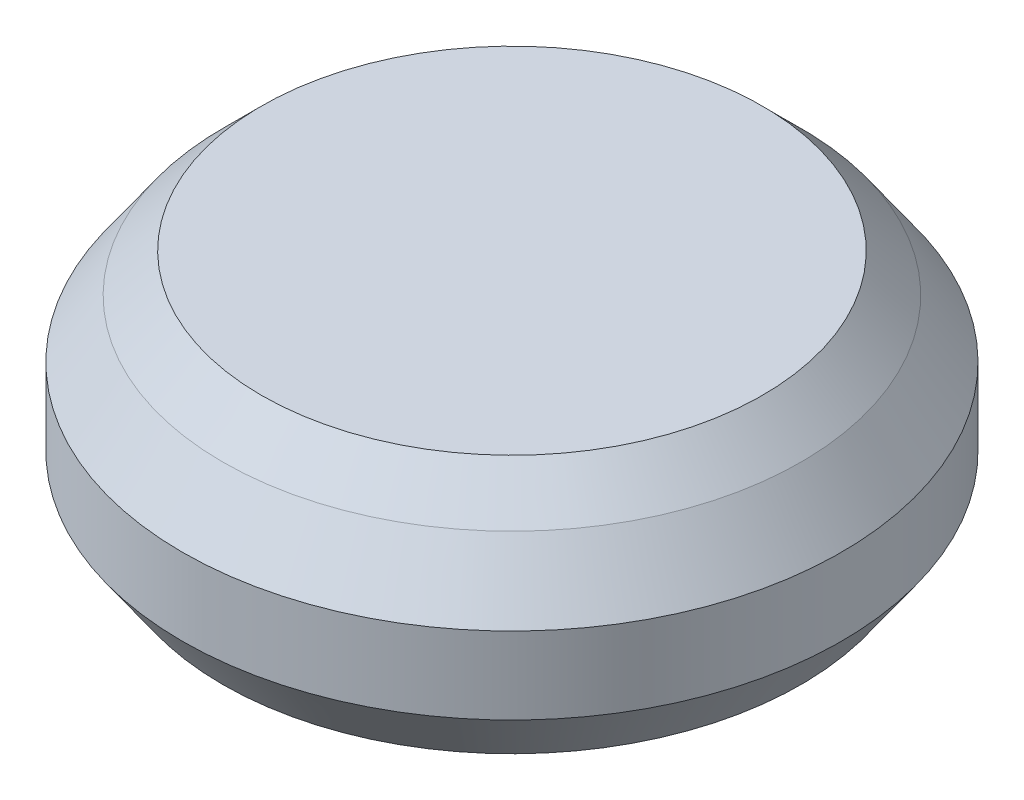
from build123d import *

# Parameters (mm, degrees)
CROQUIS1_R              = 15
SALIENTE_EXTRUIR1_DEPTH = 3
SALIENTE_EXTRUIR1_DRAFT = -35
CROQUIS2_R              = 17.100622615
SALIENTE_EXTRUIR2_DEPTH = 4
CROQUIS3_R              = 17.100622615
SALIENTE_EXTRUIR3_DEPTH = 3
SALIENTE_EXTRUIR3_TAPER = 35
CROQUIS4_R              = 15
SALIENTE_EXTRUIR4_DEPTH = 2
SALIENTE_EXTRUIR4_TAPER = 45


with BuildPart() as part:
    # Croquis1 → Saliente-Extruir1 (with draft: the straight prism first)
    with BuildSketch(Plane(origin=(0, 0, 0), x_dir=(1, 0, 0), z_dir=(0, 1, 0))):
        Circle(CROQUIS1_R)
    extrude(amount=SALIENTE_EXTRUIR1_DEPTH)
    # Saliente-Extruir1: the draft: its side faces are tilted about the plane it starts from
    saliente_extruir1_sides = [part.faces().sort_by_distance(p)[0] for p in [
        (-15, 1.5, 0),
    ]]
    draft(saliente_extruir1_sides, Plane(origin=(0, 0, 0), x_dir=(1, 0, 0), z_dir=(0, 1, 0)), SALIENTE_EXTRUIR1_DRAFT)

    # Croquis2 → Saliente-Extruir2 (add)
    with BuildSketch(Plane(origin=(0, 3, 0), x_dir=(1, 0, 0), z_dir=(0, 1, 0))):
        Circle(CROQUIS2_R)
    extrude(amount=SALIENTE_EXTRUIR2_DEPTH)

    # Croquis3 → Saliente-Extruir3 (add)
    with BuildSketch(Plane(origin=(0, 7, 0), x_dir=(1, 0, 0), z_dir=(0, 1, 0))):
        Circle(CROQUIS3_R)
    extrude(amount=SALIENTE_EXTRUIR3_DEPTH, taper=SALIENTE_EXTRUIR3_TAPER)


with BuildPart() as body_2:
    # Croquis4 → Saliente-Extruir4 (new body)
    with BuildSketch(Plane(origin=(0, 10, 0), x_dir=(1, 0, 0), z_dir=(0, 1, 0))):
        Circle(CROQUIS4_R)
    extrude(amount=SALIENTE_EXTRUIR4_DEPTH, taper=SALIENTE_EXTRUIR4_TAPER)


solid = Compound([part.part, body_2.part])
